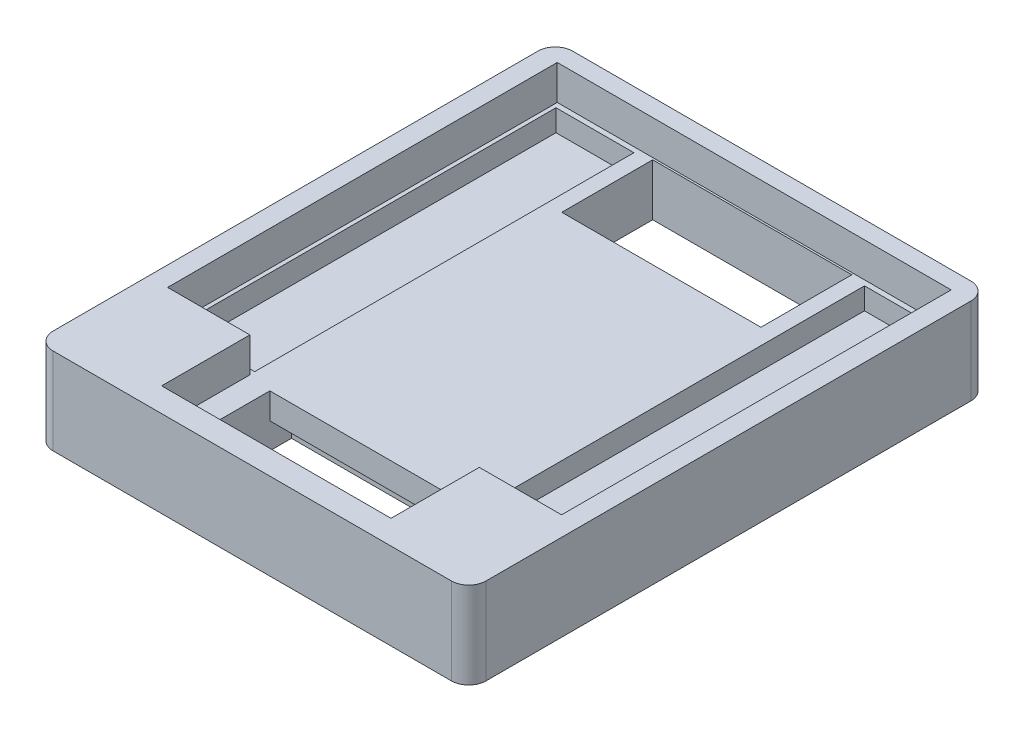
from build123d import *

# Parameters (mm, degrees)
SKETCH1_W           = 50
SKETCH1_H           = 60
BOSS_EXTRUDE1_DEPTH = 10
CUT_EXTRUDE1_DEPTH  = 4
SKETCH3_W           = 23
SKETCH3_H           = 10.5
SKETCH3_W_2         = 21
SKETCH3_H_2         = 8.5
CUT_EXTRUDE2_DEPTH  = 10
SKETCH4_W           = 9
SKETCH4_H           = 43.8
CUT_EXTRUDE3_DEPTH  = 2.5
SKETCH5_W           = 35
SKETCH5_H           = 19
CUT_EXTRUDE4_DEPTH  = 1.5
SKETCH6_W           = 12.3
SKETCH6_H           = 6.8
CUT_EXTRUDE5_DEPTH  = 1.5
FILLET1_R           = 2
SKETCH7_W           = 21
SKETCH7_H           = 2.5
CUT_EXTRUDE6_DEPTH  = 3


with BuildPart() as part:
    # Sketch1 → Boss-Extrude1 (new body)
    with BuildSketch(Plane(origin=(0, 0, 0), x_dir=(1, 0, 0), z_dir=(0, 1, 0))):
        Rectangle(SKETCH1_W, SKETCH1_H)
    extrude(amount=BOSS_EXTRUDE1_DEPTH)

    # Sketch2 → Cut-Extrude1 (cut)
    with BuildSketch(Plane(origin=(0, 10, 0), x_dir=(1, 0, 0), z_dir=(0, 1, 0))):
        Polygon((-22.75, 27.975), (22.75, 27.975), (22.75, -17.025), (13.25, -17.025), (13.25, -27.22), (-13.25, -27.22), (-13.25, -17.025), (-22.75, -17.025), align=None)
    extrude(amount=-CUT_EXTRUDE1_DEPTH, mode=Mode.SUBTRACT)

    # Sketch3 → Cut-Extrude2 (cut)
    with BuildSketch(Plane.XZ):
        with Locations((0, -22.5)):
            Rectangle(SKETCH3_W, SKETCH3_H)
        with Locations((0, 21.72)):
            Rectangle(SKETCH3_W_2, SKETCH3_H_2)
    extrude(amount=-CUT_EXTRUDE2_DEPTH, mode=Mode.SUBTRACT)

    # Sketch4 → Cut-Extrude3 (cut)
    with BuildSketch(Plane(origin=(0, 6, 0), x_dir=(1, 0, 0), z_dir=(0, 1, 0))):
        with Locations((-17.793551609, 5.475)):
            Rectangle(SKETCH4_W, SKETCH4_H)
        with Locations((17.838749051, 5.475)):
            Rectangle(SKETCH4_W, SKETCH4_H)
    extrude(amount=-CUT_EXTRUDE3_DEPTH, mode=Mode.SUBTRACT)

    # Sketch5 → Cut-Extrude4 (cut)
    with BuildSketch(Plane.XZ):
        with Locations((0, -6)):
            Rectangle(SKETCH5_W, SKETCH5_H)
    extrude(amount=-CUT_EXTRUDE4_DEPTH, mode=Mode.SUBTRACT)

    # Sketch6 → Cut-Extrude5 (cut)
    with BuildSketch(Plane.XZ):
        with Locations((0, 10)):
            Rectangle(SKETCH6_W, SKETCH6_H)
    extrude(amount=-CUT_EXTRUDE5_DEPTH, mode=Mode.SUBTRACT)

    # Fillet1
    fillet1_edges = [part.edges().sort_by_distance(p)[0] for p in [
        (-25, 5, -30),
        (-25, 5, 30),
        (25, 5, 30),
        (25, 5, -30),
    ]]
    fillet(fillet1_edges, radius=FILLET1_R)

    # Sketch7 → Cut-Extrude6 (cut)
    with BuildSketch(Plane.XZ):
        with Locations((0, 16.22)):
            Rectangle(SKETCH7_W, SKETCH7_H)
    extrude(amount=-CUT_EXTRUDE6_DEPTH, mode=Mode.SUBTRACT)


solid = part.part
